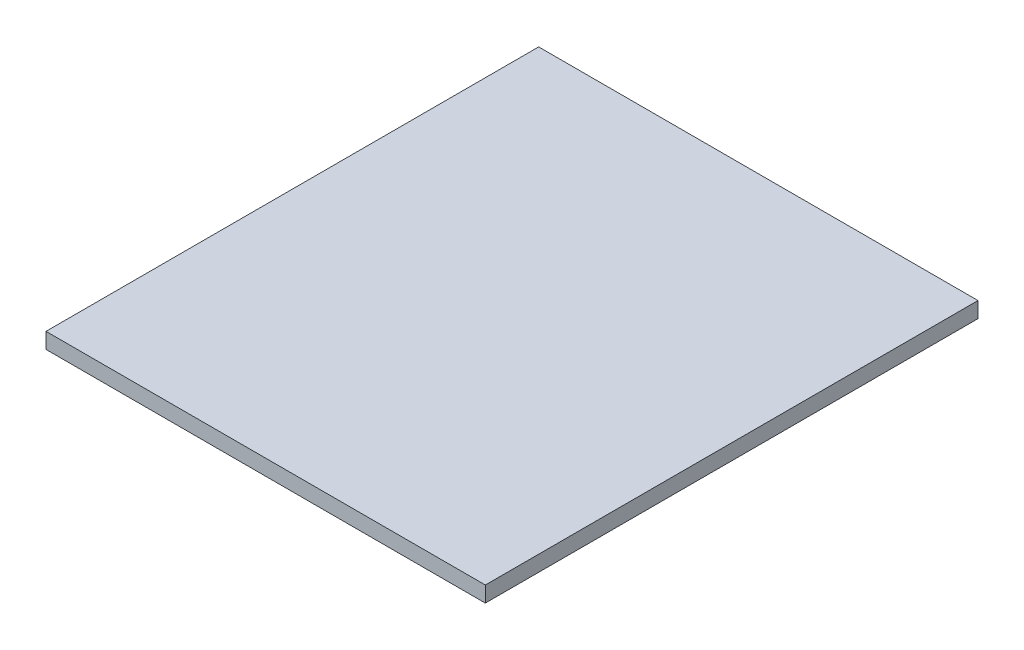
from build123d import *

# Parameters (mm, degrees)
SKETCH1_W           = 560
SKETCH1_H           = 628
BOSS_EXTRUDE1_DEPTH = 20


with BuildPart() as part:
    # Sketch1 → Boss-Extrude1 (new body)
    with BuildSketch(Plane(origin=(0, 0, 0), x_dir=(1, 0, 0), z_dir=(0, 1, 0))):
        Rectangle(SKETCH1_W, SKETCH1_H)
    extrude(amount=BOSS_EXTRUDE1_DEPTH)


solid = part.part
